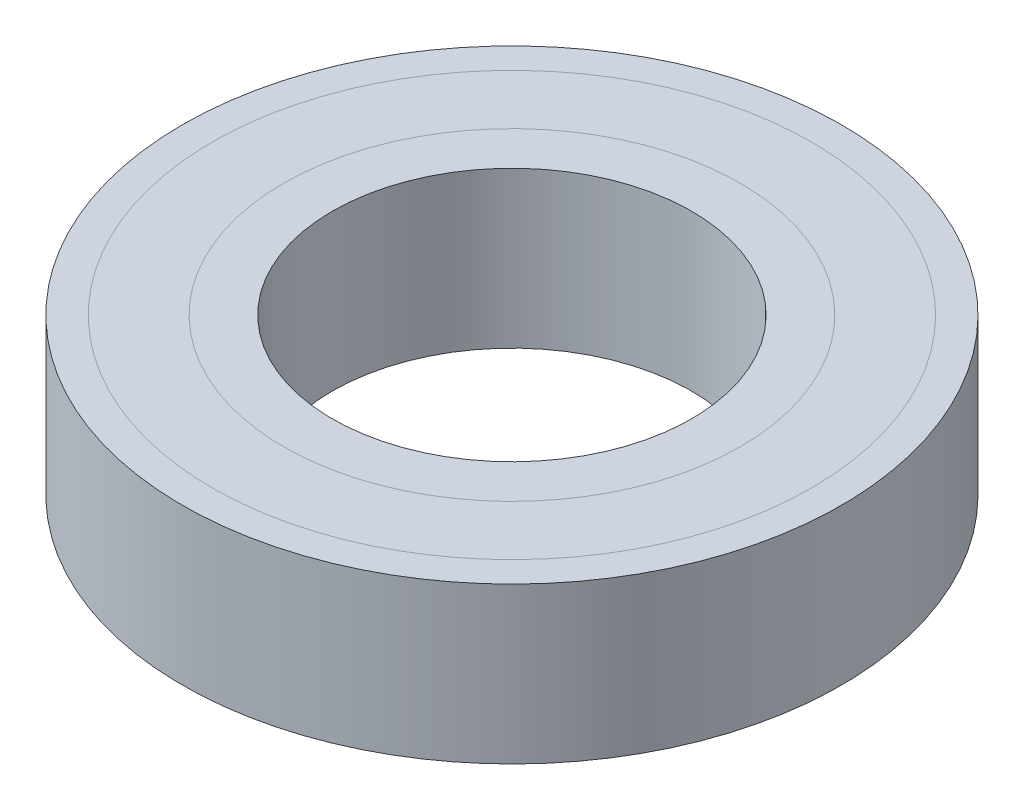
from build123d import *

# Parameters (mm, degrees)
SKETCH1_W = 12.5
SKETCH1_H = 13


with BuildPart() as part:
    # Sketch1 → Revolve1 (revolve)
    with BuildSketch(Plane.XY):
        with Locations((21.25, 0)):
            Rectangle(SKETCH1_W, SKETCH1_H)
    revolve(axis=Axis((0, 6.5, 0), (0, -1, 0)))


solid = part.part
